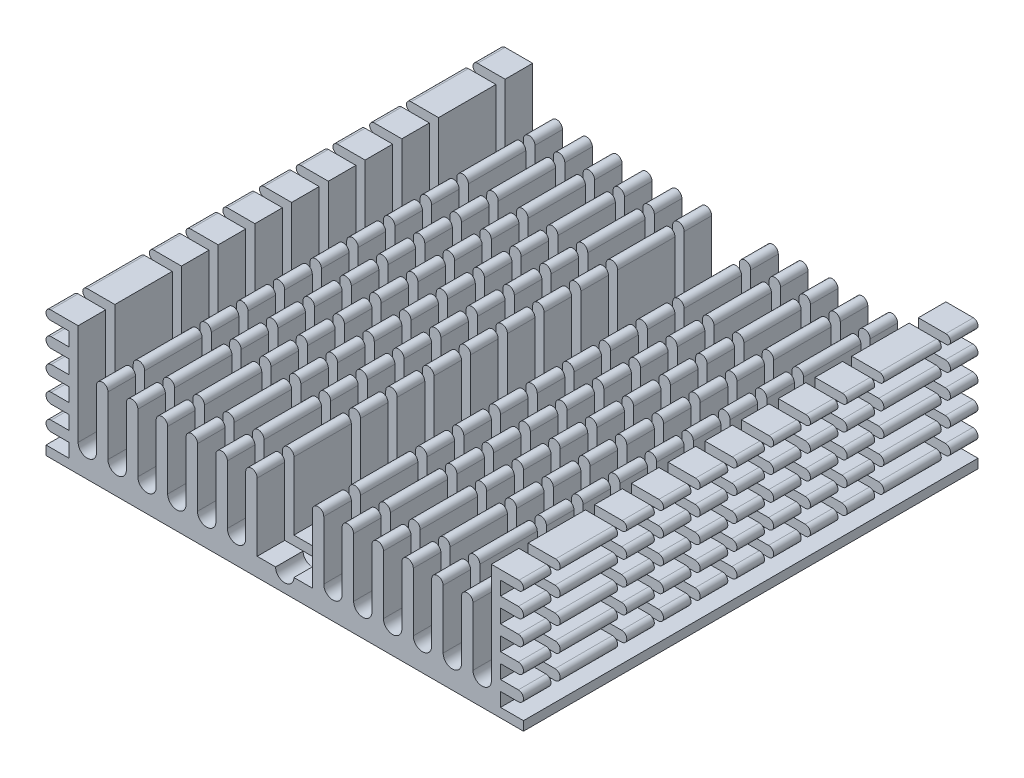
from build123d import *

# Parameters (mm, degrees)
BOSS_EXTRU_1_DEPTH           = 24.75
ESQUISSE2_W                  = 2.5
ESQUISSE2_H                  = 1.5
ENL_V_MAT_EXTRU_1_DEPTH      = 49.5
ENL_V_MAT_EXTRU_2_DEPTH      = 39.530020763
ENL_V_MAT_EXTRU_2_DEPTH_BACK = 39.530020763
ESQUISSE4_W                  = 1
ESQUISSE4_H                  = 13
ESQUISSE5_R                  = 2.25
ENL_V_MAT_EXTRU_4_DEPTH      = 39.530020763
ENL_V_MAT_EXTRU_5_DEPTH      = 58.638962517


with BuildPart() as part:
    # Esquisse1 → Boss.-Extru.1 (new, symmetric)
    with BuildSketch(Plane.XY):
        Polygon((-26, 14), (-22.5, 14), (-22.5, 10), (22.5, 10), (22.5, 14), (26, 14), (26, 0), (-26, 0), align=None)
    extrude(amount=BOSS_EXTRU_1_DEPTH, both=True)

    # Esquisse2 → Enlèv. mat.-Extru.1 (cut)
    with BuildSketch(Plane.XY.offset(24.75)):
        with BuildLine():
            Line((-22.5, 10), (-22.5, 3))
            ThreePointArc((-22.5, 3), (-21.5, 2), (-20.5, 3))
            Line((-20.5, 3), (-20.5, 10))
            Line((-20.5, 10), (-22.5, 10))
        make_face()
        with BuildLine():
            Line((-19.25, 10), (-17.25, 10))
            Line((-17.25, 10), (-17.25, 3))
            ThreePointArc((-17.25, 3), (-18.25, 2), (-19.25, 3))
            Line((-19.25, 3), (-19.25, 10))
        make_face()
        with BuildLine():
            Line((-16, 10), (-14, 10))
            Line((-14, 10), (-14, 3))
            ThreePointArc((-14, 3), (-15, 2), (-16, 3))
            Line((-16, 3), (-16, 10))
        make_face()
        with BuildLine():
            Line((-12.75, 10), (-10.75, 10))
            Line((-10.75, 10), (-10.75, 3))
            ThreePointArc((-10.75, 3), (-11.75, 2), (-12.75, 3))
            Line((-12.75, 3), (-12.75, 10))
        make_face()
        with BuildLine():
            Line((-9.5, 10), (-7.5, 10))
            Line((-7.5, 10), (-7.5, 3))
            ThreePointArc((-7.5, 3), (-8.5, 2), (-9.5, 3))
            Line((-9.5, 3), (-9.5, 10))
        make_face()
        with BuildLine():
            Line((-6.25, 10), (-4.25, 10))
            Line((-4.25, 10), (-4.25, 3))
            ThreePointArc((-4.25, 3), (-5.25, 2), (-6.25, 3))
            Line((-6.25, 3), (-6.25, 10))
        make_face()
        with BuildLine():
            Line((4.25, 10), (4.25, 3))
            ThreePointArc((4.25, 3), (5.25, 2), (6.25, 3))
            Line((6.25, 3), (6.25, 10))
            Line((6.25, 10), (4.25, 10))
        make_face()
        with BuildLine():
            Line((7.5, 10), (7.5, 3))
            ThreePointArc((7.5, 3), (8.5, 2), (9.5, 3))
            Line((9.5, 3), (9.5, 10))
            Line((9.5, 10), (7.5, 10))
        make_face()
        with BuildLine():
            Line((10.75, 10), (10.75, 3))
            ThreePointArc((10.75, 3), (11.75, 2), (12.75, 3))
            Line((12.75, 3), (12.75, 10))
            Line((12.75, 10), (10.75, 10))
        make_face()
        with BuildLine():
            Line((14, 10), (14, 3))
            ThreePointArc((14, 3), (15, 2), (16, 3))
            Line((16, 3), (16, 10))
            Line((16, 10), (14, 10))
        make_face()
        with BuildLine():
            Line((17.25, 10), (17.25, 3))
            ThreePointArc((17.25, 3), (18.25, 2), (19.25, 3))
            Line((19.25, 3), (19.25, 10))
            Line((19.25, 10), (17.25, 10))
        make_face()
        with BuildLine():
            Line((22.5, 10), (20.5, 10))
            Line((20.5, 10), (20.5, 3))
            ThreePointArc((20.5, 3), (21.5, 2), (22.5, 3))
            Line((22.5, 3), (22.5, 10))
        make_face()
        with BuildLine():
            Line((1, 2), (3, 2))
            Line((3, 2), (3, 10))
            Line((3, 10), (-3, 10))
            Line((-3, 10), (-3, 2))
            Line((-3, 2), (-1, 2))
            ThreePointArc((-1, 2), (0, 1), (1, 2))
        make_face()
        with Locations((-24.75, 12.25)):
            Rectangle(ESQUISSE2_W, ESQUISSE2_H)
        with Locations((-24.75, 9.625)):
            Rectangle(ESQUISSE2_W, ESQUISSE2_H)
        with Locations((-24.75, 7)):
            Rectangle(ESQUISSE2_W, ESQUISSE2_H)
        with Locations((-24.75, 4.375)):
            Rectangle(ESQUISSE2_W, ESQUISSE2_H)
        with Locations((-24.75, 1.75)):
            Rectangle(ESQUISSE2_W, ESQUISSE2_H)
        with Locations((24.75, 1.75)):
            Rectangle(ESQUISSE2_W, ESQUISSE2_H)
        with Locations((24.75, 4.375)):
            Rectangle(ESQUISSE2_W, ESQUISSE2_H)
        with Locations((24.75, 7)):
            Rectangle(ESQUISSE2_W, ESQUISSE2_H)
        with Locations((24.75, 9.625)):
            Rectangle(ESQUISSE2_W, ESQUISSE2_H)
        with Locations((24.75, 12.25)):
            Rectangle(ESQUISSE2_W, ESQUISSE2_H)
    extrude(amount=-ENL_V_MAT_EXTRU_1_DEPTH, mode=Mode.SUBTRACT)

    # Esquisse4 → Enlèv. mat.-Extru.2 (cut, two sides: drawn at the far end of the back side and taken through both)
    with BuildSketch(Plane(origin=(0, 0, 0), x_dir=(0, 0, -1), z_dir=(1, 0, 0)).offset(-ENL_V_MAT_EXTRU_2_DEPTH_BACK)):
        with Locations((-2, 7.5)):
            Rectangle(ESQUISSE4_W, ESQUISSE4_H)
        with Locations((-6, 7.5)):
            Rectangle(ESQUISSE4_W, ESQUISSE4_H)
        with Locations((-10, 7.5)):
            Rectangle(ESQUISSE4_W, ESQUISSE4_H)
        with Locations((-14, 7.5)):
            Rectangle(ESQUISSE4_W, ESQUISSE4_H)
        with Locations((-21.25, 7.5)):
            Rectangle(ESQUISSE4_W, ESQUISSE4_H)
        with Locations((21.25, 7.5)):
            Rectangle(ESQUISSE4_W, ESQUISSE4_H)
        with Locations((14, 7.5)):
            Rectangle(ESQUISSE4_W, ESQUISSE4_H)
        with Locations((10, 7.5)):
            Rectangle(ESQUISSE4_W, ESQUISSE4_H)
        with Locations((6, 7.5)):
            Rectangle(ESQUISSE4_W, ESQUISSE4_H)
        with Locations((2, 7.5)):
            Rectangle(ESQUISSE4_W, ESQUISSE4_H)
    extrude(amount=ENL_V_MAT_EXTRU_2_DEPTH + ENL_V_MAT_EXTRU_2_DEPTH_BACK, mode=Mode.SUBTRACT)

    # Esquisse5 → Enlèv. mat.-Extru.4 (cut, through all)
    with BuildSketch(Plane(origin=(0, 0, 0), x_dir=(1, 0, 0), z_dir=(0, 1, 0))):
        with Locations((0, 13.75)):
            Circle(ESQUISSE5_R)
        with Locations((0, -5.25)):
            Circle(ESQUISSE5_R)
    extrude(amount=ENL_V_MAT_EXTRU_4_DEPTH, mode=Mode.SUBTRACT)

    # Esquisse6 → Enlèv. mat.-Extru.5 (cut, through all)
    with BuildSketch(Plane.XY.offset(24.75)):
        with BuildLine():
            Line((-20.5, 9.375), (-20.5, 10.625))
            Line((-20.5, 10.625), (-19.25, 10.625))
            Line((-19.25, 10.625), (-19.25, 9.375))
            ThreePointArc((-19.25, 9.375), (-19.875, 10), (-20.5, 9.375))
        make_face()
        with BuildLine():
            Line((-17.25, 10.625), (-16, 10.625))
            Line((-16, 10.625), (-16, 9.375))
            ThreePointArc((-16, 9.375), (-16.625, 10), (-17.25, 9.375))
            Line((-17.25, 9.375), (-17.25, 10.625))
        make_face()
        with BuildLine():
            Line((-14, 10.625), (-12.75, 10.625))
            Line((-12.75, 10.625), (-12.75, 9.375))
            ThreePointArc((-12.75, 9.375), (-13.375, 10), (-14, 9.375))
            Line((-14, 9.375), (-14, 10.625))
        make_face()
        with BuildLine():
            Line((-10.75, 10.625), (-9.5, 10.625))
            Line((-9.5, 10.625), (-9.5, 9.375))
            ThreePointArc((-9.5, 9.375), (-10.125, 10), (-10.75, 9.375))
            Line((-10.75, 9.375), (-10.75, 10.625))
        make_face()
        with BuildLine():
            Line((-7.5, 10.625), (-6.25, 10.625))
            Line((-6.25, 10.625), (-6.25, 9.375))
            ThreePointArc((-6.25, 9.375), (-6.875, 10), (-7.5, 9.375))
            Line((-7.5, 9.375), (-7.5, 10.625))
        make_face()
        with BuildLine():
            Line((-4.25, 10.625), (-3, 10.625))
            Line((-3, 10.625), (-3, 9.375))
            ThreePointArc((-3, 9.375), (-3.625, 10), (-4.25, 9.375))
            Line((-4.25, 9.375), (-4.25, 10.625))
        make_face()
        with BuildLine():
            Line((3, 10.625), (3, 9.375))
            ThreePointArc((3, 9.375), (3.625, 10), (4.25, 9.375))
            Line((4.25, 9.375), (4.25, 10.625))
            Line((4.25, 10.625), (3, 10.625))
        make_face()
        with BuildLine():
            Line((6.25, 10.625), (6.25, 9.375))
            ThreePointArc((6.25, 9.375), (6.875, 10), (7.5, 9.375))
            Line((7.5, 9.375), (7.5, 10.625))
            Line((7.5, 10.625), (6.25, 10.625))
        make_face()
        with BuildLine():
            Line((9.5, 10.625), (9.5, 9.375))
            ThreePointArc((9.5, 9.375), (10.125, 10), (10.75, 9.375))
            Line((10.75, 9.375), (10.75, 10.625))
            Line((10.75, 10.625), (9.5, 10.625))
        make_face()
        with BuildLine():
            Line((12.75, 10.625), (12.75, 9.375))
            ThreePointArc((12.75, 9.375), (13.375, 10), (14, 9.375))
            Line((14, 9.375), (14, 10.625))
            Line((14, 10.625), (12.75, 10.625))
        make_face()
        with BuildLine():
            Line((16, 10.625), (16, 9.375))
            ThreePointArc((16, 9.375), (16.625, 10), (17.25, 9.375))
            Line((17.25, 9.375), (17.25, 10.625))
            Line((17.25, 10.625), (16, 10.625))
        make_face()
        with BuildLine():
            Line((19.25, 10.625), (19.25, 9.375))
            ThreePointArc((19.25, 9.375), (19.875, 10), (20.5, 9.375))
            Line((20.5, 9.375), (20.5, 10.625))
            Line((20.5, 10.625), (19.25, 10.625))
        make_face()
        with BuildLine():
            Line((-25.5, 14), (-26.5, 14))
            Line((-26.5, 14), (-26.5, 13))
            Line((-26.5, 13), (-25.5, 13))
            ThreePointArc((-25.5, 13), (-26, 13.5), (-25.5, 14))
        make_face()
        with BuildLine():
            Line((-25.4375, 11.5), (-26.5625, 11.5))
            Line((-26.5625, 11.5), (-26.5625, 10.375))
            Line((-26.5625, 10.375), (-25.4375, 10.375))
            ThreePointArc((-25.4375, 10.375), (-26, 10.9375), (-25.4375, 11.5))
        make_face()
        with BuildLine():
            Line((-25.4375, 8.875), (-26.5625, 8.875))
            Line((-26.5625, 8.875), (-26.5625, 7.75))
            Line((-26.5625, 7.75), (-25.4375, 7.75))
            ThreePointArc((-25.4375, 7.75), (-26, 8.3125), (-25.4375, 8.875))
        make_face()
        with BuildLine():
            Line((-25.4375, 6.25), (-26.5625, 6.25))
            Line((-26.5625, 6.25), (-26.5625, 5.125))
            Line((-26.5625, 5.125), (-25.4375, 5.125))
            ThreePointArc((-25.4375, 5.125), (-26, 5.6875), (-25.4375, 6.25))
        make_face()
        with BuildLine():
            Line((-25.4375, 3.625), (-26.5625, 3.625))
            Line((-26.5625, 3.625), (-26.5625, 2.5))
            Line((-26.5625, 2.5), (-25.4375, 2.5))
            ThreePointArc((-25.4375, 2.5), (-26, 3.0625), (-25.4375, 3.625))
        make_face()
        with BuildLine():
            Line((26.5625, 2.5), (25.4375, 2.5))
            ThreePointArc((25.4375, 2.5), (26, 3.0625), (25.4375, 3.625))
            Line((25.4375, 3.625), (26.5625, 3.625))
            Line((26.5625, 3.625), (26.5625, 2.5))
        make_face()
        with BuildLine():
            Line((26.5625, 5.125), (25.4375, 5.125))
            ThreePointArc((25.4375, 5.125), (26, 5.6875), (25.4375, 6.25))
            Line((25.4375, 6.25), (26.5625, 6.25))
            Line((26.5625, 6.25), (26.5625, 5.125))
        make_face()
        with BuildLine():
            Line((26.5625, 7.75), (25.4375, 7.75))
            ThreePointArc((25.4375, 7.75), (26, 8.3125), (25.4375, 8.875))
            Line((25.4375, 8.875), (26.5625, 8.875))
            Line((26.5625, 8.875), (26.5625, 7.75))
        make_face()
        with BuildLine():
            Line((26.5625, 10.375), (25.4375, 10.375))
            ThreePointArc((25.4375, 10.375), (26, 10.9375), (25.4375, 11.5))
            Line((25.4375, 11.5), (26.5625, 11.5))
            Line((26.5625, 11.5), (26.5625, 10.375))
        make_face()
        with BuildLine():
            Line((26.5, 13), (25.5, 13))
            ThreePointArc((25.5, 13), (26, 13.5), (25.5, 14))
            Line((25.5, 14), (26.5, 14))
            Line((26.5, 14), (26.5, 13))
        make_face()
    extrude(amount=-ENL_V_MAT_EXTRU_5_DEPTH, mode=Mode.SUBTRACT)


solid = part.part
